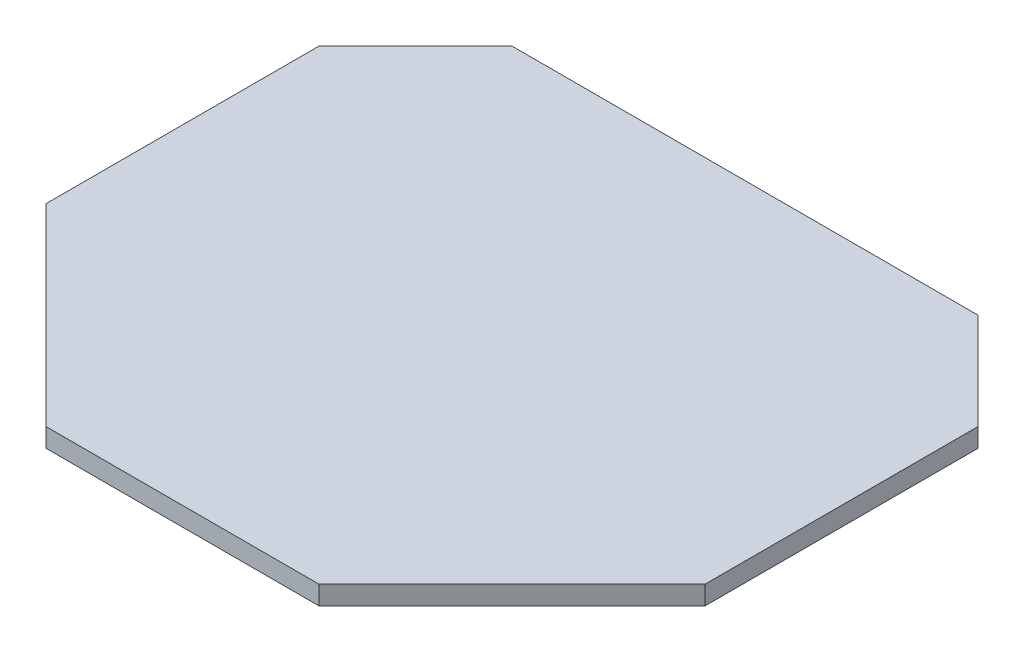
from build123d import *

# Parameters (mm, degrees)
BOSS_EXTRUDE1_DEPTH = 2


with BuildPart() as part:
    # Sketch1 → Boss-Extrude1 (new body)
    with BuildSketch(Plane(origin=(0, 0, 0), x_dir=(1, 0, 0), z_dir=(0, 1, 0))):
        Polygon((-35, -14.497474683), (-14.497474683, -35), (14.497474683, -35), (35, -14.497474683), (35, 14.497474683), (24.748737342, 24.748737342), (-24.748737342, 24.748737342), (-35, 14.497474683), align=None)
    extrude(amount=BOSS_EXTRUDE1_DEPTH)


solid = part.part
